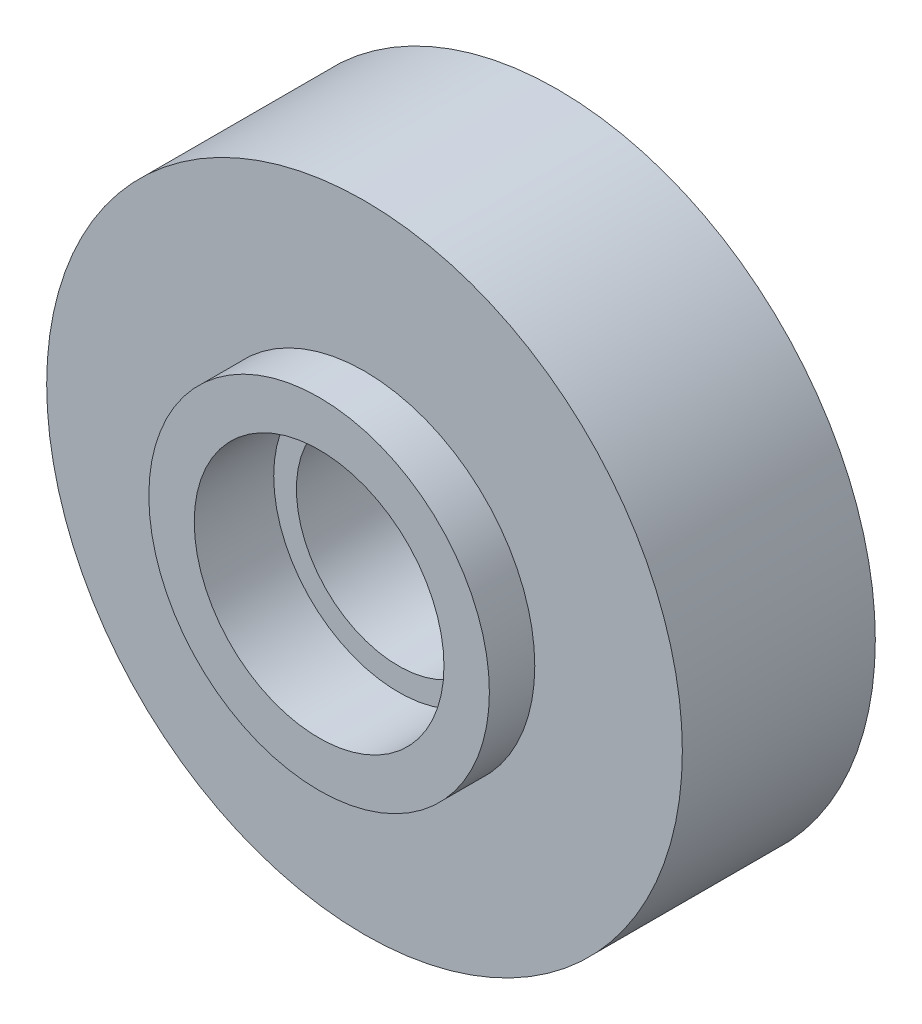
from build123d import *

# Parameters (mm, degrees)
SKETCH1_R           = 28
BOSS_EXTRUDE1_DEPTH = 17
SKETCH2_R           = 11
CUT_EXTRUDE1_DEPTH  = 3
SKETCH3_R           = 9
CUT_EXTRUDE2_DEPTH  = 43
CUT_EXTRUDE3_START  = -6.5
SKETCH4_R           = 11
CUT_EXTRUDE3_DEPTH  = 6.5
BOSS_EXTRUDE2_START = 4
SKETCH6_R           = 15
SKETCH6_R_2         = 11
BOSS_EXTRUDE2_DEPTH = 4


with BuildPart() as part:
    # Sketch1 → Boss-Extrude1 (new body)
    with BuildSketch(Plane.XY):
        Circle(SKETCH1_R)
    extrude(amount=BOSS_EXTRUDE1_DEPTH)

    # Sketch2 → Cut-Extrude1 (cut)
    with BuildSketch(Plane.XY.offset(17)):
        Circle(SKETCH2_R)
    extrude(amount=-CUT_EXTRUDE1_DEPTH, mode=Mode.SUBTRACT)

    # Sketch3 → Cut-Extrude2 (cut, through all)
    with BuildSketch(Plane.XY.offset(14)):
        Circle(SKETCH3_R)
    extrude(amount=-CUT_EXTRUDE2_DEPTH, mode=Mode.SUBTRACT)

    # Sketch4 → Cut-Extrude3 (cut)
    with BuildSketch(Plane(origin=(0, 0, 0), x_dir=(-1, 0, 0), z_dir=(0, 0, -1)).offset(CUT_EXTRUDE3_START)):
        Circle(SKETCH4_R)
    extrude(amount=CUT_EXTRUDE3_DEPTH, mode=Mode.SUBTRACT)

    # Sketch6 → Boss-Extrude2 (add)
    with BuildSketch(Plane.XY.offset(17).offset(BOSS_EXTRUDE2_START)):
        Circle(SKETCH6_R)
        Circle(SKETCH6_R_2, mode=Mode.SUBTRACT)
    extrude(amount=-BOSS_EXTRUDE2_DEPTH)


solid = part.part
